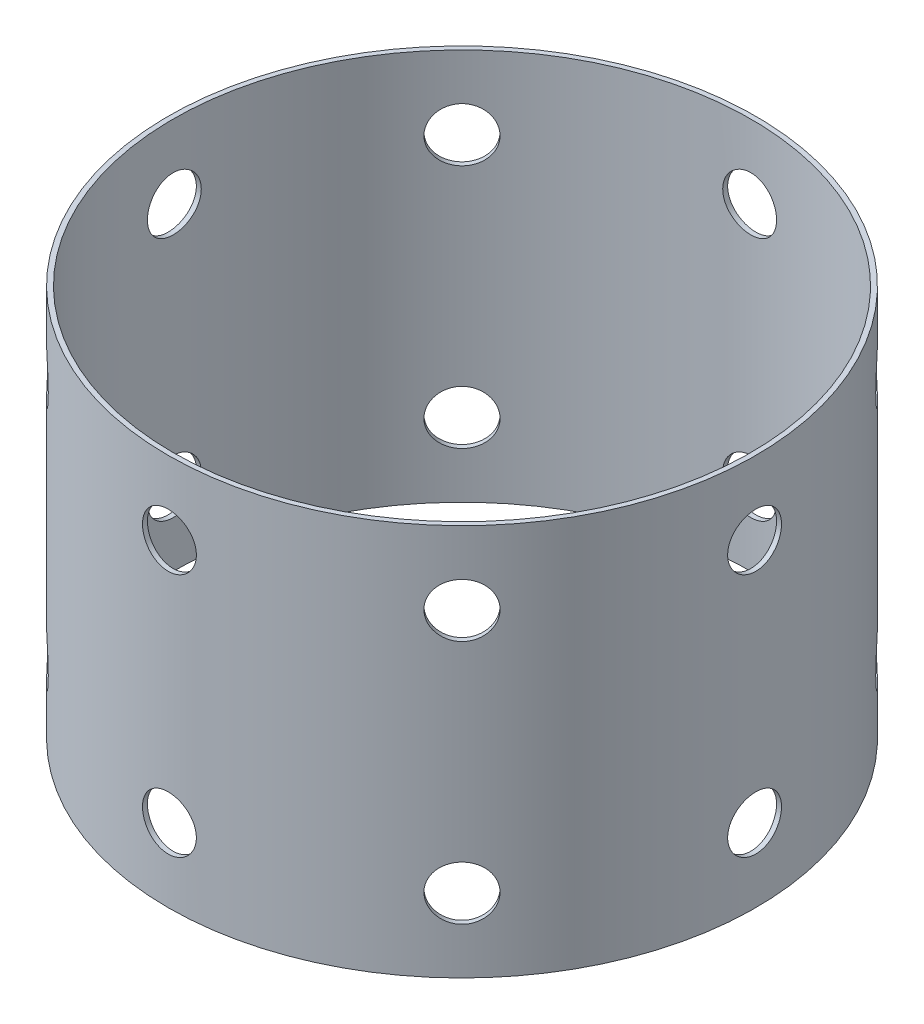
from build123d import *

# Parameters (mm, degrees)
SKETCH2_R                              = 76.2
SKETCH2_R_2                            = 74.93
BOSS_EXTRUDE1_DEPTH                    = 101.6
LOX_TO_KERO_LOX_SIDE_HOLES_REACH       = 168.559
LOX_TO_KERO_LOX_SIDE_HOLES_END_RADIUS  = 76.2
SKETCH3_R                              = 6.985
CIRPATTERN1_COUNT                      = 8
LOX_TO_KERO_KERO_SIDE_HOLES_REACH      = 168.559
LOX_TO_KERO_KERO_SIDE_HOLES_END_RADIUS = 76.2
SKETCH4_R                              = 6.985
CIRPATTERN2_COUNT                      = 8


with BuildPart() as part:
    # Sketch2 → Boss-Extrude1 (new body)
    with BuildSketch(Plane(origin=(0, 0, 0), x_dir=(1, 0, 0), z_dir=(0, 1, 0))):
        Circle(SKETCH2_R)
        Circle(SKETCH2_R_2, mode=Mode.SUBTRACT)
    extrude(amount=BOSS_EXTRUDE1_DEPTH)

    # LOX to Kero, LOX Side Holes: up to this cylinder (the profile starts inside it)
    lox_to_kero_lox_side_holes_end = Plane(origin=(0, 82.55, 0), z_dir=(0, -1, 0)) * Cylinder(LOX_TO_KERO_LOX_SIDE_HOLES_END_RADIUS, 490.518, mode=Mode.PRIVATE)
    # Sketch3 → LOX to Kero, LOX Side Holes (cut, up to the surface)
    with BuildSketch(Plane(origin=(0, 127, 0), x_dir=(0, 0, -1), z_dir=(1, 0, 0)), mode=Mode.PRIVATE) as lox_to_kero_lox_side_holes_sk1:
        with Locations((0, -44.45)):
            Circle(SKETCH3_R)
    lox_to_kero_lox_side_holes_tool1 = extrude(lox_to_kero_lox_side_holes_sk1.sketch, amount=LOX_TO_KERO_LOX_SIDE_HOLES_REACH, mode=Mode.PRIVATE) & lox_to_kero_lox_side_holes_end
    lox_to_kero_lox_side_holes = lox_to_kero_lox_side_holes_tool1.solids().sort_by_distance((0, 82.55, 0))[0]
    add(lox_to_kero_lox_side_holes, mode=Mode.SUBTRACT)

    # CirPattern1: LOX to Kero, LOX Side Holes ×8 about axis
    cirpattern1_axis = Axis((0, 101.6, 0), (0, 1, 0))
    for i in range(1, CIRPATTERN1_COUNT):
        add(lox_to_kero_lox_side_holes.rotate(cirpattern1_axis, i * 360 / CIRPATTERN1_COUNT), mode=Mode.SUBTRACT)

    # LOX to Kero, Kero Side Holes: up to this cylinder (the profile starts inside it)
    lox_to_kero_kero_side_holes_end = Plane(origin=(0, 19.05, 0), z_dir=(0, -1, 0)) * Cylinder(LOX_TO_KERO_KERO_SIDE_HOLES_END_RADIUS, 490.518, mode=Mode.PRIVATE)
    # Sketch4 → LOX to Kero, Kero Side Holes (cut, up to the surface)
    with BuildSketch(Plane(origin=(0, -25.4, 0), x_dir=(0, 0, 1), z_dir=(1, 0, 0)), mode=Mode.PRIVATE) as lox_to_kero_kero_side_holes_sk1:
        with Locations((0, -44.45)):
            Circle(SKETCH4_R)
    lox_to_kero_kero_side_holes_tool1 = extrude(lox_to_kero_kero_side_holes_sk1.sketch, amount=LOX_TO_KERO_KERO_SIDE_HOLES_REACH, mode=Mode.PRIVATE) & lox_to_kero_kero_side_holes_end
    lox_to_kero_kero_side_holes = lox_to_kero_kero_side_holes_tool1.solids().sort_by_distance((0, 19.05, 0))[0]
    add(lox_to_kero_kero_side_holes, mode=Mode.SUBTRACT)

    # CirPattern2: LOX to Kero, Kero Side Holes ×8 about axis
    cirpattern2_axis = Axis((0, 0, 0), (0, 1, 0))
    for i in range(1, CIRPATTERN2_COUNT):
        add(lox_to_kero_kero_side_holes.rotate(cirpattern2_axis, i * 360 / CIRPATTERN2_COUNT), mode=Mode.SUBTRACT)


solid = part.part
